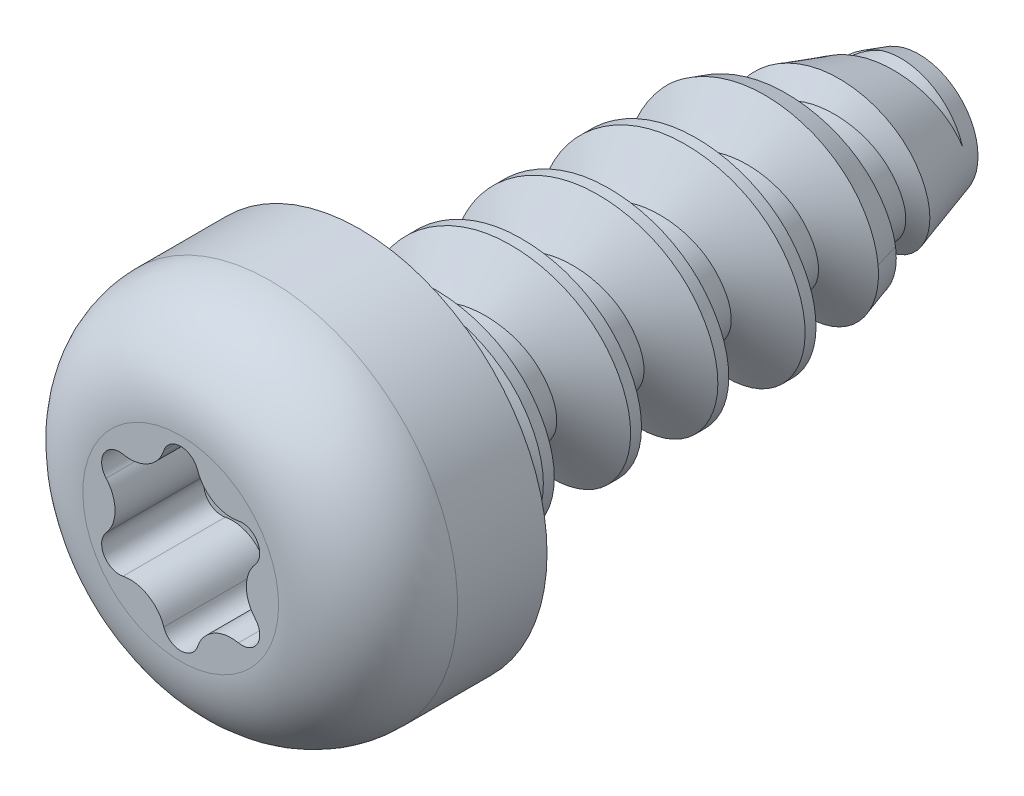
from build123d import *

# Parameters (mm, degrees)
SKETCH1_R           = 1.675
EXTRUDE3_DEPTH      = 1.6
SKETCH4_W           = 5
SKETCH4_H           = 0.577812616
SWEEP1_PITCH        = 0.78
LPATTERN3_COUNT     = 6
LPATTERN3_PITCH     = 0.78
LPATTERN3_COL_COUNT = 2
LPATTERN3_COL_PITCH = 0.78
CUT_EXTRUDE1_DEPTH  = 0.914285714
CIRPATTERN1_COUNT   = 6


with BuildPart() as part:
    # Sketch1 → Extrude3 (new body)
    with BuildSketch(Plane.XY):
        Circle(SKETCH1_R)
    extrude(amount=EXTRUDE3_DEPTH)

    # Sketch11 → Cut-Revolve3 (revolve, cut)
    with BuildSketch(Plane(origin=(0, 0, 0), x_dir=(0, 0, -1), z_dir=(1, 0, 0))):
        with BuildLine():
            Line((-0.8, 1.675), (-0.8, 1.775))
            Line((-0.8, 1.775), (-1.7, 1.775))
            Line((-1.7, 1.775), (-1.7, 0.875))
            Line((-1.7, 0.875), (-1.6, 0.875))
            ThreePointArc((-1.6, 0.875), (-1.365685425, 1.440685425), (-0.8, 1.675))
        make_face()
    revolve(axis=Axis((0, 0, 0), (0, 0, 1)), mode=Mode.SUBTRACT)


with BuildPart() as body_2:
    # Sketch4 → Revolve1 (revolve)
    with BuildSketch(Plane(origin=(0, 0, 0), x_dir=(0, 0, -1), z_dir=(1, 0, 0))):
        with Locations((2.5, 0.288906308)):
            Rectangle(SKETCH4_W, SKETCH4_H)
    revolve(axis=Axis((0, 0, -5), (0, 0, -1)))

    # Sweep1: the profile of Sketch14 profile screwed along a right-hand helix of 1.5 turns, 6 arcs to a turn; built about Z, then put on its axis
    sweep1_z = Axis((0, 0, 0), (0, 0, 1))
    sweep1_corners = [(1, 0, -0.04875), (1, 0, 0.04875), (0.577512616, 0, 0.292673205), (0.577512616, 0, -0.292673205)]
    with BuildLine(mode=Mode.PRIVATE) as sweep1_profile:
        Line(sweep1_corners[0], sweep1_corners[1])
        Line(sweep1_corners[1], sweep1_corners[2])
        Line(sweep1_corners[2], sweep1_corners[3])
        Line(sweep1_corners[3], sweep1_corners[0])
    sweep1_cap = Face(sweep1_profile.wire())
    sweep1_turn_angles = [0, 30, 60, 90, 120, 150, 180, 210, 240, 270, 300, 330, 360]
    sweep1_turn_weights = [1, 0.8660254037844387, 1, 0.8660254037844387, 1, 0.8660254037844387, 1, 0.8660254037844387, 1, 0.8660254037844387, 1, 0.8660254037844387, 1]
    sweep1_turn_rails = [Edge.make_bspline([Vector(p[0], p[1], 0).rotate(sweep1_z, sweep1_turn_angles[k]) / sweep1_turn_weights[k] + Vector(0, 0, p[2] + SWEEP1_PITCH * sweep1_turn_angles[k] / 360) for k in range(13)], [0, 0, 0, 1, 1, 2, 2, 3, 3, 4, 4, 5, 5, 6, 6, 6], 2, sweep1_turn_weights) for p in sweep1_corners]
    sweep1_turn_sides = [Face.make_surface_from_curves(sweep1_turn_rails[p[0]], sweep1_turn_rails[p[1]]) for p in [(0, 1), (1, 2), (2, 3), (3, 0)]]
    sweep1_last_angles = [360, 390, 420, 450, 480, 510, 540]
    sweep1_last_weights = [1, 0.8660254037844387, 1, 0.8660254037844387, 1, 0.8660254037844342, 1]
    sweep1_last_rails = [Edge.make_bspline([Vector(p[0], p[1], 0).rotate(sweep1_z, sweep1_last_angles[k]) / sweep1_last_weights[k] + Vector(0, 0, p[2] + SWEEP1_PITCH * sweep1_last_angles[k] / 360) for k in range(7)], [0, 0, 0, 1, 1, 2, 2, 3, 3, 3], 2, sweep1_last_weights) for p in sweep1_corners]
    sweep1_last_sides = [Face.make_surface_from_curves(sweep1_last_rails[p[0]], sweep1_last_rails[p[1]]) for p in [(0, 1), (1, 2), (2, 3), (3, 0)]]
    sweep1 = Plane(origin=(0, 0, -0.4875), x_dir=(0, 1, 0), z_dir=(0, 0, -1)) * Solid(Shell([*sweep1_turn_sides, *sweep1_last_sides, sweep1_cap, sweep1_cap.rotate(sweep1_z, 540).moved(Location((0, 0, SWEEP1_PITCH * 540 / 360)))]))
    add(sweep1)

    # LPattern3: Sweep1 ×6
    with Locations(*[(0, 0, -i * LPATTERN3_PITCH) for i in range(1, LPATTERN3_COUNT)]):
        add(sweep1)


with BuildPart() as part_1:
    add(part.part)

    add(body_2.part)  # LPattern3 col merges body 2
    # LPattern3 col: Sweep1 ×2
    with Locations(*[(0, 0, i * LPATTERN3_COL_PITCH) for i in range(1, LPATTERN3_COL_COUNT)]):
        add(sweep1)

    # Sketch13 → Cut-Revolve4 (revolve, cut)
    with BuildSketch(Plane(origin=(0, 0, 0), x_dir=(0, 0, -1), z_dir=(1, 0, 0)), mode=Mode.PRIVATE) as cut_revolve4_sk:
        Polygon((5, 0.527812616), (3.464877009, 1), (5, 1), (6.56, 1), (6.56, 0), (5, 0), align=None)
    revolve(cut_revolve4_sk.sketch.rotate(Axis((0, 0, 0), (0, 0, -1)), 90), axis=Axis((0, 0, 0), (0, 0, -1)), mode=Mode.SUBTRACT)

    # Sketch12 → Cut-Extrude1 (cut)
    with BuildSketch(Plane.XY.offset(1.6)):
        with BuildLine():
            Line((-0.293512341, 0.508378287), (0, 0))
            Line((0, 0), (0.293512341, 0.508378287))
            ThreePointArc((0.293512341, 0.508378287), (0.206232496, 0.582576585), (0.150879114, 0.682871957))
            ThreePointArc((0.150879114, 0.682871957), (0, 0.7914375), (-0.150879114, 0.682871957))
            ThreePointArc((-0.150879114, 0.682871957), (-0.206232496, 0.582576585), (-0.293512341, 0.508378287))
        make_face()
    cut_extrude1 = extrude(amount=-CUT_EXTRUDE1_DEPTH, mode=Mode.SUBTRACT)

    # CirPattern1: Cut-Extrude1 ×6 about axis
    cirpattern1_axis = Axis((0, 0, 0), (0, 0, 1))
    for i in range(1, CIRPATTERN1_COUNT):
        add(cut_extrude1.rotate(cirpattern1_axis, i * 360 / CIRPATTERN1_COUNT), mode=Mode.SUBTRACT)


solid = part_1.part
